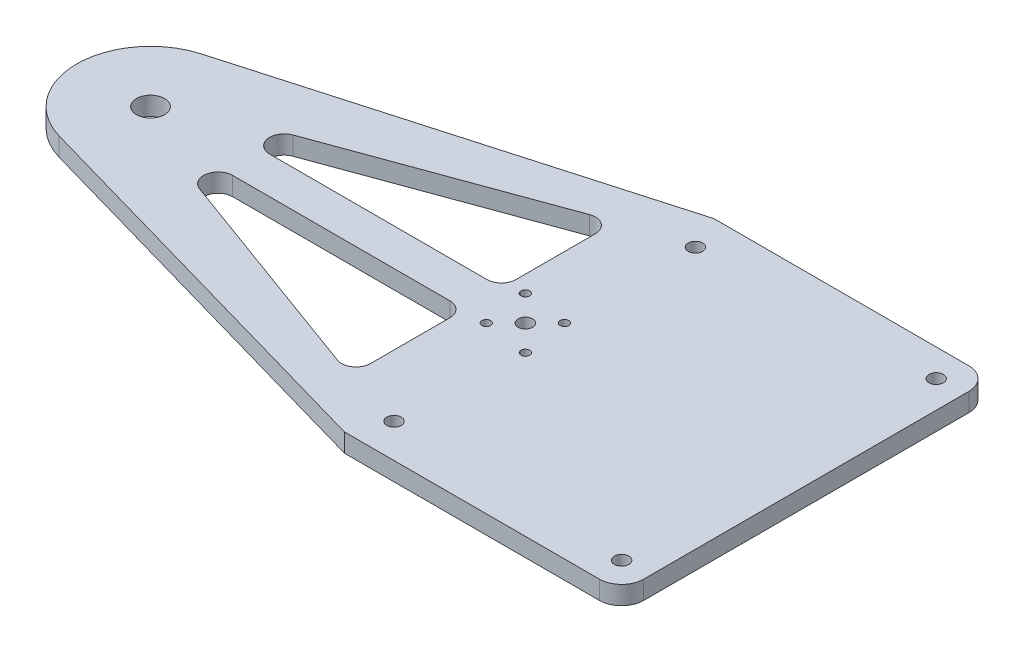
from build123d import *

# Parameters (mm, degrees)
SKETCH1_W           = 95.25
SKETCH1_H           = 127
BOSS_EXTRUDE1_DEPTH = 6.35
BOSS_EXTRUDE3_DEPTH = 6.35
SKETCH5_R           = 4.826
SKETCH5_R_2         = 2.5
SKETCH5_R_3         = 1.5
CUT_EXTRUDE1_DEPTH  = 213.985474857
CUT_EXTRUDE2_DEPTH  = 213.985474857
FILLET9_R           = 5
FILLET10_R          = 7.62
SKETCH7_R           = 2.4892
CUT_EXTRUDE3_DEPTH  = 213.985474857


with BuildPart() as part:
    # Sketch1 → Boss-Extrude1 (new body)
    with BuildSketch(Plane(origin=(0, 0, 0), x_dir=(1, 0, 0), z_dir=(0, 1, 0))):
        Rectangle(SKETCH1_W, SKETCH1_H)
    extrude(amount=BOSS_EXTRUDE1_DEPTH)

    # Sketch4 → Boss-Extrude3 (add)
    with BuildSketch(Plane(origin=(0, 6.35, 0), x_dir=(1, 0, 0), z_dir=(0, 1, 0))):
        with BuildLine():
            Line((-47.625, 63.5), (-184.759922998, 24.427842145))
            ThreePointArc((-184.759922998, 24.427842145), (-203.2, 0), (-184.759922998, -24.427842145))
            Line((-184.759922998, -24.427842145), (-47.625, -63.5))
            Line((-47.625, -63.5), (-47.625, 63.5))
        make_face()
    extrude(amount=-BOSS_EXTRUDE3_DEPTH)

    # Sketch5 → Cut-Extrude1 (cut, through all)
    with BuildSketch(Plane(origin=(0, 6.35, 0), x_dir=(1, 0, 0), z_dir=(0, 1, 0))):
        with Locations((-177.8, 0)):
            Circle(SKETCH5_R)
        with Locations((-48.9458, 0)):
            Circle(SKETCH5_R_2)
        with Locations((-42.228285579, 6.717514421)):
            Circle(SKETCH5_R_3)
        with Locations((-57.784634765, 8.838834765)):
            Circle(SKETCH5_R_3)
        with Locations((-40.106965235, -8.838834765)):
            Circle(SKETCH5_R_3)
        with Locations((-55.663314421, -6.717514421)):
            Circle(SKETCH5_R_3)
    extrude(amount=-CUT_EXTRUDE1_DEPTH, mode=Mode.SUBTRACT)

    # Sketch6 → Cut-Extrude2 (cut, through all)
    with BuildSketch(Plane(origin=(0, 6.35, 0), x_dir=(1, 0, 0), z_dir=(0, 1, 0))):
        Polygon((-63.5, 45.771509083), (-171.45, 6.35), (-63.5, 6.35), align=None)
        Polygon((-63.5, -6.35), (-63.5, -45.771509083), (-171.45, -6.35), align=None)
    extrude(amount=-CUT_EXTRUDE2_DEPTH, mode=Mode.SUBTRACT)

    # Fillet9
    fillet9_edges = [part.edges().sort_by_distance(p)[0] for p in [
        (-171.45, 3.175, 6.35),
        (-63.5, 3.175, 6.35),
        (-63.5, 3.175, 45.771509083),
        (-63.5, 3.175, -6.35),
        (-171.45, 3.175, -6.35),
        (-63.5, 3.175, -45.771509083),
    ]]
    fillet(fillet9_edges, radius=FILLET9_R)

    # Fillet10
    fillet10_edges = [part.edges().sort_by_distance(p)[0] for p in [
        (47.625, 3.175, -63.5),
        (47.625, 3.175, 63.5),
    ]]
    fillet(fillet10_edges, radius=FILLET10_R)

    # Sketch7 → Cut-Extrude3 (cut, through all)
    with BuildSketch(Plane(origin=(0, 6.35, 0), x_dir=(1, 0, 0), z_dir=(0, 1, 0))):
        with Locations((-42.286053483, -51.811053483)):
            Circle(SKETCH7_R)
        with Locations((-42.286053483, 51.811053483)):
            Circle(SKETCH7_R)
        with Locations((38.202339924, 54.077339924)):
            Circle(SKETCH7_R)
        with Locations((38.202339924, -54.077339924)):
            Circle(SKETCH7_R)
    extrude(amount=-CUT_EXTRUDE3_DEPTH, mode=Mode.SUBTRACT)


solid = part.part
